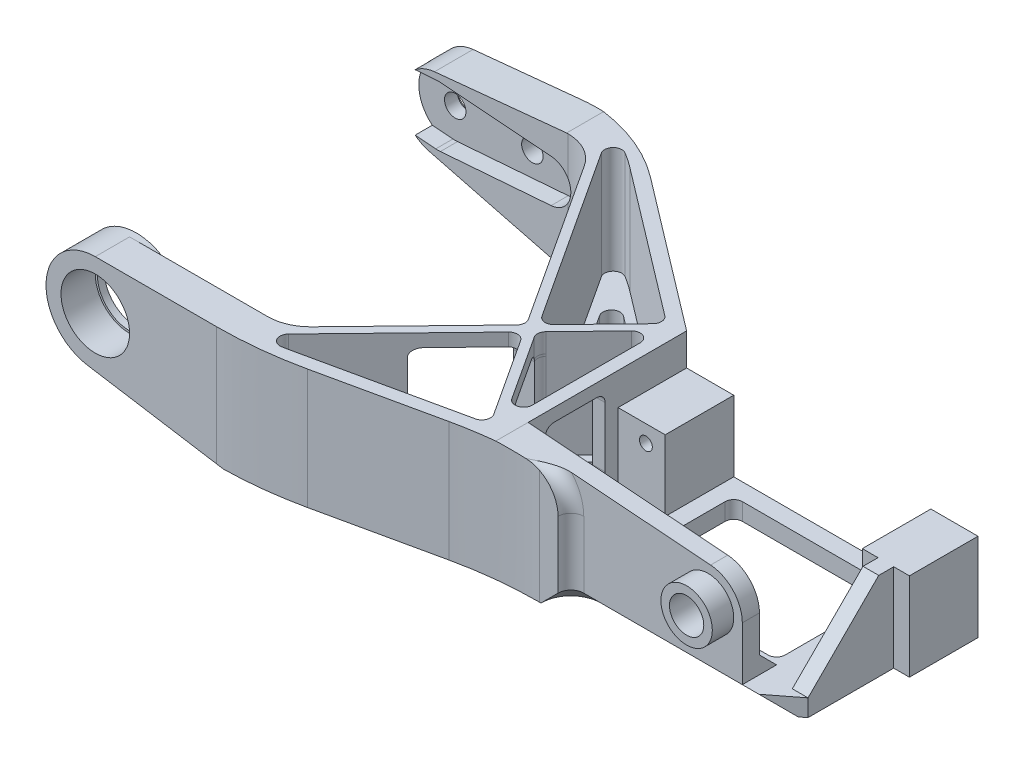
from build123d import *

# Parameters (mm, degrees)
BOSS_EXTRUDE1_DEPTH      = 2
BOSS_EXTRUDE2_DEPTH      = 12
SKETCH3_R                = 2.999999999999994
BOSS_EXTRUDE3_DEPTH      = 1
SKETCH4_R                = 2.0000000000000027
CUT_EXTRUDE1_DEPTH       = 11
SKETCH5_R                = 0.7500000000000021
SKETCH5_R_2              = 0.7500000000000004
CUT_EXTRUDE2_DEPTH       = 11
BOSS_EXTRUDE4_DEPTH      = 14
SKETCH8_R                = 1.2499999999999978
CUT_EXTRUDE3_DEPTH       = 14
SKETCH9_R                = 4.000000000000006
CUT_EXTRUDE4_DEPTH       = 14
CUT_EXTRUDE5_DEPTH       = 14
CUT_EXTRUDE6_DEPTH       = 14
CUT_EXTRUDE7_DEPTH       = 12.5
BOSS_EXTRUDE5_DEPTH      = 12.5
CUT_EXTRUDE8_DEPTH       = 1.5
CUT_EXTRUDE9_REACH       = 65.532
BOSS_EXTRUDE7_START      = 2
BOSS_EXTRUDE7_DEPTH      = 2
FILLET2_R                = 45.00000000000001
FILLET3_R                = 20
BOSS_EXTRUDE6_START      = -1.8333333333333333
BOSS_EXTRUDE6_DEPTH      = 1.8333333333333333
CUT_EXTRUDE10_DEPTH      = 57.152137092011024
SKETCH19_W               = 19.000000000000007
SKETCH19_H               = 14
CUT_EXTRUDE11_DEPTH      = 57.152137092011024
SKETCH20_W               = 6.9999999999999964
SKETCH20_H               = 9.000000000000002
CUT_EXTRUDE12_DEPTH      = 31.666666666666668
FILLET4_R                = 20
CUT_EXTRUDE15_START      = -12
CUT_EXTRUDE15_DEPTH      = 12
FILLET6_R                = 1
BOSS_EXTRUDE8_START      = 0.8
SKETCH22_R               = 5.750000000000003
SKETCH22_R_2             = 3.7499999999999996
BOSS_EXTRUDE8_DEPTH      = 0.8
SKETCH23_W               = 34
SKETCH23_H               = 3.7500000000000018
CUT_EXTRUDE13_DEPTH      = 10.8
CUT_EXTRUDE14_DEPTH      = 10
CUT_EXTRUDE14_DEPTH_BACK = 1.5
SKETCH25_R               = 2.999999999999994
FILLET7_R                = 1.5
CHAMFER1_SIZE            = 2
SKETCH28_R               = 2.5000000000000018
CUT_EXTRUDE16_DEPTH      = 1
CUT_EXTRUDE17_DEPTH      = 20
BOSS_EXTRUDE9_DEPTH      = 12.5
BOSS_EXTRUDE10_DEPTH     = 1.5
FILLET8_R                = 1
FILLET9_R                = 5
FILLET10_R               = 5
CUT_EXTRUDE18_DEPTH      = 20
CUT_EXTRUDE18_DEPTH_BACK = 2
SKETCH32_R               = 2.4999999999999987


# Some blends are built 0.0001 mm under size
with BuildPart() as part:
    # Sketch1 → Boss-Extrude1 (new body)
    with BuildSketch(Plane(origin=(0, 0, 0), x_dir=(1, 0, 0), z_dir=(0, 1, 0))):
        Polygon((0, 0), (2.69e-15, -22), (34, -21.999999999999996), (34, 0), align=None)
    extrude(amount=BOSS_EXTRUDE1_DEPTH)

    # Sketch2 → Boss-Extrude2 (add)
    with BuildSketch(Plane(origin=(0, 2, 0), x_dir=(1, 0, 0), z_dir=(0, 1, 0))):
        Polygon((0, 0), (5.5, 0), (5.500000000000001, -8), (9.8e-16, -8), align=None)
        Polygon((34, 0), (28.500000000000004, -6.7e-16), (28.500000000000004, -8), (34, -8), align=None)
        Polygon((2.69e-15, -22), (34, -22), (34, -18), (0, -18), align=None)
    extrude(amount=BOSS_EXTRUDE2_DEPTH)

    # Sketch3 → Boss-Extrude3 (add)
    with BuildSketch(Plane.XY.offset(22)):
        with Locations(Location((23, 8.25, 0), (0, 0, 180))):
            Circle(SKETCH3_R)
    extrude(amount=BOSS_EXTRUDE3_DEPTH)

    # Sketch4 → Cut-Extrude1 (cut)
    with BuildSketch(Plane.XY.offset(23)):
        with Locations((23.000000000000004, 8.25)):
            Circle(SKETCH4_R)
    extrude(amount=-CUT_EXTRUDE1_DEPTH, mode=Mode.SUBTRACT)

    # Sketch5 → Cut-Extrude2 (cut)
    with BuildSketch(Plane(origin=(0, 0, 0), x_dir=(-1, 0, 0), z_dir=(0, 0, -1))):
        with Locations((-30.750000000000004, 8.25)):
            Circle(SKETCH5_R)
        with Locations((-3.2500000000000027, 8.25)):
            Circle(SKETCH5_R_2)
    extrude(amount=-CUT_EXTRUDE2_DEPTH, mode=Mode.SUBTRACT)

    # Sketch7 → Boss-Extrude4 (add)
    with BuildSketch(Plane.XZ):
        Polygon((-50.49999999999999, 22.999999999999993), (-26.999999999999996, 22.999999999999993), (-26.99999999999999, -15.000000000000007), (-50.49999999999999, -15.000000000000009), (-50.49999999999999, -17.500000000000007), (-22.99999999999999, -17.5), (0, 0), (2.69e-15, 22), (-22.999999999999986, 26.999999999999993), (-50.49999999999999, 26.999999999999993), align=None)
    extrude(amount=-BOSS_EXTRUDE4_DEPTH)

    # Sketch8 → Cut-Extrude3 (cut)
    with BuildSketch(Plane(origin=(4.42e-15, 0, -17.499999999999996), x_dir=(-1, 0, -2.7e-16), z_dir=(2.7e-16, 0, -1))):
        with Locations((41.99999999999999, 8.25)):
            Circle(SKETCH8_R)
        with Locations((32.999999999999986, 8.25)):
            Circle(SKETCH8_R)
    extrude(amount=-CUT_EXTRUDE3_DEPTH, mode=Mode.SUBTRACT)

    # Sketch9 → Cut-Extrude4 (cut)
    with BuildSketch(Plane.XY.offset(26.999999999999993)):
        with Locations((-41.99999999999999, 8.25)):
            Circle(SKETCH9_R)
    extrude(amount=-CUT_EXTRUDE4_DEPTH, mode=Mode.SUBTRACT)

    # Sketch10 → Cut-Extrude5 (cut)
    with BuildSketch(Plane.XY.offset(-15.000000000000005)):
        with BuildLine():
            Line((-27, 14), (-42.41713391946437, 12.479479789907062))
            ThreePointArc((-42.41713391946437, 12.479479789907062), (-46.23746408869767, 8.576187211578807), (-43.059529225196606, 4.134189287521319))
            Line((-43.059529225196606, 4.134189287521319), (-27, 0))
            Line((-27, 0), (-50.49999999999999, 0))
            Line((-50.49999999999999, 0), (-50.49999999999999, 14))
            Line((-50.49999999999999, 14), (-27, 14))
        make_face()
    extrude(amount=-CUT_EXTRUDE5_DEPTH, mode=Mode.SUBTRACT)

    # Sketch11 → Cut-Extrude6 (cut)
    with BuildSketch(Plane(origin=(0, 0, 22.999999999999993), x_dir=(-1, 0, 0), z_dir=(0, 0, -1))):
        with BuildLine():
            Line((26.999999999999996, 0), (42.91778785709473, 2.5737190477065464))
            ThreePointArc((42.91778785709473, 2.5737190477065464), (47.7315406077113, 8.71037187376764), (41.99999999999999, 14.000000000000002))
            Line((41.99999999999999, 14.000000000000002), (53.107989459604404, 14))
            Line((53.107989459604404, 14), (50.75249059667796, -2.6e-16))
            Line((50.75249059667796, -2.6e-16), (26.999999999999996, 0))
        make_face()
    extrude(amount=-CUT_EXTRUDE6_DEPTH, mode=Mode.SUBTRACT)

    # Sketch12 → Cut-Extrude7 (cut)
    with BuildSketch(Plane(origin=(0, 14, 0), x_dir=(1, 0, 0), z_dir=(0, 1, 0))):
        Polygon((-1.4999999999999991, -0.7308367651977024), (-1.4999999999999967, -20.791051874442683), (-23.161161377563868, -25.499999999999993), (-25.499999999999996, -25.499999999999993), (-25.499999999999996, 16), (-23.505474031994225, 16), align=None)
    extrude(amount=-CUT_EXTRUDE7_DEPTH, mode=Mode.SUBTRACT)

    # Sketch13 → Boss-Extrude5 (add)
    with BuildSketch(Plane(origin=(0, 1.5, 0), x_dir=(1, 0, 0), z_dir=(0, 1, 0))):
        Polygon((-24.80378563154179, -25.49999999999999), (-9.397373577762142, -9.599836040721089), (-9.957626569346198, -8.740990337546899), (-25.5, -24.781473027551826), (-25.499999999999996, -25.499999999999993), align=None)
        Polygon((-9.397373577762142, -9.599836040721089), (-8.683812037309256, -8.86340594598965), (-9.24406502889331, -8.004560242815458), (-9.957626569346198, -8.740990337546899), align=None)
        Polygon((-1.4999999999999967, -20.791051874442683), (-1.499999999999997, -19.875906001026767), (-8.683812037309256, -8.863405945989648), (-9.397373577762142, -9.599836040721089), (-2.0228353945063846, -20.90471174281363), align=None)
        Polygon((-9.24406502889331, -8.004560242815458), (-8.683812037309256, -8.863405945989648), (-1.499999999999999, -1.449363737645875), (-1.4999999999999991, -0.7308367651977008), (-1.9008849961326661, -0.426042538899241), align=None)
        Polygon((-9.957626569346198, -8.740990337546899), (-9.24406502889331, -8.00456024281546), (-24.90302057584715, 16.000000000000004), (-25.499999999999996, 16), (-25.499999999999996, 15.084854126584107), align=None)
    extrude(amount=BOSS_EXTRUDE5_DEPTH)

    # Sketch14 → Cut-Extrude8 (cut)
    with BuildSketch(Plane(origin=(0, 1.5, 0), x_dir=(1, 0, 0), z_dir=(0, 1, 0))):
        Polygon((-24.499999999999993, -22.312370614538644), (-24.499999999999993, 11.72160188498378), (-11.231441101383142, -8.618574729104147), align=None)
        Polygon((-3.6531639202682733, -20.23577426615841), (-9.550682126630978, -11.195111838626723), (-22.22194073935927, -24.272464879004225), align=None)
        Polygon((-2.499999999999997, -16.512653759426488), (-2.499999999999997, -3.9184661506589857), (-7.409997505272318, -8.985821554432402), align=None)
        Polygon((-9.090756480024478, -6.409284444909828), (-22.2835643411881, 13.814768821324591), (-3.4035269015017935, -0.539787870567154), align=None)
    extrude(amount=-CUT_EXTRUDE8_DEPTH, mode=Mode.SUBTRACT)

    # Sketch15 → Cut-Extrude9 (cut, up to next)
    with BuildSketch(Plane.XY.offset(22), mode=Mode.PRIVATE) as cut_extrude9_sk1:
        with BuildLine():
            Line((4.5e-16, 14), (23.3015030272886, 12.23862080480656))
            ThreePointArc((23.3015030272886, 12.23862080480656), (25.933088142994887, 10.969741521803641), (26.999999999999996, 8.25))
            Line((26.999999999999996, 8.25), (26.999999999999993, 2))
            Line((26.999999999999993, 2), (34, 2))
            Line((34, 2), (34, 14))
            Line((34, 14), (4.5e-16, 14))
        make_face()
    cut_extrude9_tool1 = extrude(cut_extrude9_sk1.sketch, amount=-CUT_EXTRUDE9_REACH, mode=Mode.PRIVATE) & part.part
    add(cut_extrude9_tool1.solids().sort_by_distance((27.381696, 9.361321, 22))[0], mode=Mode.SUBTRACT)

    # Sketch21 → Boss-Extrude7 (add)
    with BuildSketch(Plane.XY.offset(-15.000000000000005).offset(BOSS_EXTRUDE7_START)):
        with BuildLine():
            ThreePointArc((-26.999999999999943, 6.75000000000008), (-27.796728102183568, 6.0586221822959825), (-28.807692307692307, 5.757407423689289))
            Line((-28.807692307692307, 5.757407423689288), (-41.730769230769226, 4.7603703931649965))
            ThreePointArc((-41.730769230769226, 4.7603703931649965), (-42, 4.75), (-42.26923076923077, 4.760370393164998))
            Line((-42.26923076923077, 4.760370393164998), (-44.672999998769185, 4.945825215491785))
            ThreePointArc((-44.672999998769185, 4.945825215491784), (-43.90987743633794, 4.4533082587379855), (-43.059529225196606, 4.1341892875213215))
            Line((-43.059529225196606, 4.134189287521321), (-27, 0))
            Line((-27, 0), (-27, 6.750000000000096))
        make_face()
        with BuildLine():
            ThreePointArc((-28.807692307692307, 10.742592576310718), (-27.796728102183568, 10.441377817704026), (-26.999999999999943, 9.749999999999927))
            Line((-27, 9.749999999999911), (-27, 13.999999999999995))
            Line((-27, 13.999999999999995), (-42.41713391946437, 12.479479789907062))
            ThreePointArc((-42.41713391946437, 12.47947978990706), (-43.61284817835047, 12.182075883498637), (-44.67299999876919, 11.554174784508215))
            Line((-44.67299999876919, 11.554174784508216), (-42.26923076923077, 11.739629606835004))
            ThreePointArc((-42.26923076923077, 11.739629606835004), (-41.99999999999999, 11.75), (-41.730769230769226, 11.739629606835))
            Line((-41.730769230769226, 11.739629606835), (-28.807692307692307, 10.742592576310717))
        make_face()
    extrude(amount=-BOSS_EXTRUDE7_DEPTH)

    # Fillet2
    fillet2_edges = [part.edges().sort_by_distance(p)[0] for p in [
        (-22.999999999999986, 7, 26.999999999999993),
        (2.69e-15, 7, 22),
    ]]
    fillet(fillet2_edges, radius=FILLET2_R)

    # Fillet3
    fillet3_edges = [part.edges().sort_by_distance(p)[0] for p in [
        (-22.99999999999999, 7, -17.5),
    ]]
    fillet(fillet3_edges, radius=FILLET3_R)

    # Sketch17 → Boss-Extrude6 (add)
    with BuildSketch(Plane(origin=(34, 0, 0), x_dir=(0, 0, -1), z_dir=(1, 0, 0)).offset(BOSS_EXTRUDE6_START)):
        Polygon((-8, 2), (-8.000000000000002, 12.000000000000002), (-18.000000000000004, 2), align=None)
    extrude(amount=-BOSS_EXTRUDE6_DEPTH)

    # Sketch18 → Cut-Extrude10 (cut, through all)
    with BuildSketch(Plane(origin=(0, 2, 0), x_dir=(1, 0, 0), z_dir=(0, 1, 0))):
        Polygon((26.999999999999996, -22), (32.16666666666667, -18.000000000000004), (32.16666666666667, -8), (34, -8), (34, -22), align=None)
    extrude(amount=-CUT_EXTRUDE10_DEPTH, mode=Mode.SUBTRACT)

    # Sketch19 → Cut-Extrude11 (cut, through all)
    with BuildSketch(Plane(origin=(0, 2, 0), x_dir=(1, 0, 0), z_dir=(0, 1, 0))):
        with Locations((17, -9)):
            Rectangle(SKETCH19_W, SKETCH19_H)
    extrude(amount=-CUT_EXTRUDE11_DEPTH, mode=Mode.SUBTRACT)

    # Sketch20 → Cut-Extrude12 (cut)
    with BuildSketch(Plane(origin=(0, 0, 0), x_dir=(-1.2e-16, 0, -1), z_dir=(1, 0, -1.2e-16))):
        with Locations((-12.999999999999998, 8.000000000000002)):
            Rectangle(SKETCH20_W, SKETCH20_H)
    extrude(amount=-CUT_EXTRUDE12_DEPTH, mode=Mode.SUBTRACT)

    # Fillet4
    # the kernel refuses this fillet: 20 mm, written as the material it adds along each edge
    with BuildSketch(Plane(origin=(-23.505474031994225, 14, -16), x_dir=(-1, 0, 4.194e-14), z_dir=(0, -1, 0))) as fillet4_piece_1:
        with BuildLine():
            CenterArc((8.409206628950624, -18.73063327415942), FILLET4_R, 110.52297839821651, 16.722873016890844)
            Line((-3.695520386341062, -2.809716721232338), (-3.9376149266468965, -2.491298390173796))
            Line((-3.9376149266468965, -2.491298390173796), (-0.24209454030583458, 0.3184183310585423))
            Line((-0.24209454030583458, 0.3184183310585423), (-1.678e-14, 0.3999999999999986))
            ThreePointArc((-1.678e-14, 0.3999999999999986), (0.6987732719264567, 0.4000000000000279), (1.257313342150992, 0.37461266548318706))
            Line((1.257313342150992, 0.37461266548318706), (1.3975465438529469, 0))
        make_face()
    extrude(amount=12.5)
    with BuildSketch(Plane(origin=(-23.161161377563868, 14, 25.499999999999993), x_dir=(0.9771763639228016, 0, -0.21242964433104106), z_dir=(0, -1, 0))) as fillet4_piece_2:
        with BuildLine():
            CenterArc((2.1145334406858454, -20.000000000000004), FILLET4_R, 89.99999999999999, 10.718469344394151)
            Line((-1.6051335957935529, -0.34894208604207216), (-1.6795269365231402, 0.0440790722370862))
            ThreePointArc((-1.6795269365231402, 0.0440790722370862), (-0.8875386556291909, 0.21639950254808357), (-0.08497185773241613, 0.39087054556911927))
            Line((-0.08497185773241613, 0.39087054556911927), (-5.8e-16, 0.4000000000000013))
            Line((-5.8e-16, 0.4000000000000013), (2.114533440685851, 0.40000000000000124))
            Line((2.114533440685851, 0.40000000000000124), (2.1145334406858516, -1e-17))
        make_face()
    extrude(amount=12.5)

    # Sketch27 → Cut-Extrude15 (cut)
    with BuildSketch(Plane(origin=(0, 14, 0), x_dir=(1, 0, 0), z_dir=(0, 1, 0)).offset(CUT_EXTRUDE15_START)):
        Polygon((2.2e-15, -18), (26.999999999999996, -18), (26.999999999999996, -18.5), (6e-17, -18.5), align=None)
    extrude(amount=CUT_EXTRUDE15_DEPTH, mode=Mode.SUBTRACT)

    # Fillet6
    # the kernel refuses this fillet: 1 mm, written as the material it adds along each edge
    with BuildSketch(Plane(origin=(26.500000000000004, 2, 2.000000000000001), x_dir=(0, 0, 1), z_dir=(0, -1, 0))) as fillet6_piece_1:
        with BuildLine():
            CenterArc((FILLET6_R, FILLET6_R), FILLET6_R, 180, 90)
            Line((-8.9e-16, FILLET6_R), (0, 0))
            Line((0, 0), (FILLET6_R, 0))
        make_face()
    extrude(amount=2)
    with BuildSketch(Plane(origin=(26.500000000000004, 2, 16), x_dir=(0, 0, -1), z_dir=(0, -1, 0))) as fillet6_piece_2:
        with BuildLine():
            CenterArc((FILLET6_R, -FILLET6_R), FILLET6_R, 90, 89.9999999999998)
            Line((0, -FILLET6_R), (0, 0))
            Line((0, 0), (FILLET6_R, 0))
        make_face()
    extrude(amount=2)
    with BuildSketch(Plane(origin=(7.499999999999998, 2, 16), x_dir=(1, 0, 0), z_dir=(0, -1, 0))) as fillet6_piece_3:
        with BuildLine():
            CenterArc((FILLET6_R, -FILLET6_R), FILLET6_R, 90, 90)
            Line((0, -FILLET6_R), (0, 0))
            Line((0, 0), (FILLET6_R, 0))
        make_face()
    extrude(amount=2)
    with BuildSketch(Plane(origin=(7.499999999999998, 2, 2.000000000000001), x_dir=(0, 0, 1), z_dir=(0, -1, 0))) as fillet6_piece_4:
        with BuildLine():
            CenterArc((FILLET6_R, -FILLET6_R), FILLET6_R, 90, 89.99999999999989)
            Line((0, -FILLET6_R), (0, 0))
            Line((0, 0), (FILLET6_R, 0))
        make_face()
    extrude(amount=2)
    with BuildSketch(Plane(origin=(-25.499999999999996, 12.5, 9.500000000000004), x_dir=(1.2e-16, 0, 1), z_dir=(-1, 0, 1.2e-16))) as fillet6_piece_5:
        with BuildLine():
            CenterArc((FILLET6_R, -FILLET6_R), FILLET6_R, 90, 90)
            Line((0, -FILLET6_R), (0, 0))
            Line((0, 0), (FILLET6_R, 0))
        make_face()
    extrude(amount=1.4999999999999964)
    with BuildSketch(Plane(origin=(1.16e-15, 12.5, 9.5), x_dir=(1.2e-16, 0, 1), z_dir=(-1, 0, 1.2e-16))) as fillet6_piece_6:
        with BuildLine():
            CenterArc((FILLET6_R, -FILLET6_R), FILLET6_R, 90, 90)
            Line((0, -FILLET6_R), (0, 0))
            Line((0, 0), (FILLET6_R, 0))
        make_face()
    extrude(amount=1.4999999999999991)
    with BuildSketch(Plane(origin=(-5.768541026619242, 12.5, 9.5), x_dir=(0, -1, 0), z_dir=(-1, 0, 1.2e-16))) as fillet6_piece_7_section:
        with BuildLine():
            CenterArc((FILLET6_R, FILLET6_R), FILLET6_R, 180, 90)
            Line((0, FILLET6_R), (0, 0))
            Line((0, 0), (FILLET6_R, 0))
        make_face()
    fillet6_piece_7 = extrude(amount=7.424525481742719, mode=Mode.PRIVATE)
    fillet6_piece_7 = split(fillet6_piece_7, bisect_by=Plane(origin=(-8.289063092873498, 12.280120088337053, 9.468540483161206), z_dir=(-0.8375498045171993, 0, 0.5463609841059311)), keep=Keep.TOP, mode=Mode.PRIVATE)
    fillet6_piece_7 = split(fillet6_piece_7, bisect_by=Plane(origin=(-9.124212615356338, 12.280120088337053, 9.317920687920878), z_dir=(0.7181696078856677, 0, 0.6958681012299287)), keep=Keep.TOP, mode=Mode.PRIVATE)
    fillet6_piece_7 = split(fillet6_piece_7, bisect_by=Plane(origin=(-9.126612897390702, 12.280120088337053, 10.01490146726714), z_dir=(0.8375498045172003, 0, -0.5463609841059295)), keep=Keep.TOP, mode=Mode.PRIVATE)
    add(fillet6_piece_7)
    with BuildSketch(Plane(origin=(-5.768541026619242, 12.5, 9.5), x_dir=(0, -1, 0), z_dir=(-1, 0, 1.2e-16))) as fillet6_piece_8_section:
        with BuildLine():
            CenterArc((FILLET6_R, FILLET6_R), FILLET6_R, 180, 90)
            Line((0, FILLET6_R), (0, 0))
            Line((0, 0), (FILLET6_R, 0))
        make_face()
    fillet6_piece_8 = extrude(amount=7.424525481742719, mode=Mode.PRIVATE)
    fillet6_piece_8 = split(fillet6_piece_8, bisect_by=Plane(origin=(-9.348823528983395, 12.081147055371739, 9.549730037251988), z_dir=(-0.7181696078856677, 0, -0.6958681012299287)), keep=Keep.TOP, mode=Mode.PRIVATE)
    fillet6_piece_8 = split(fillet6_piece_8, bisect_by=Plane(origin=(-9.431936596322846, 12.081147055371739, 9.546852298687588), z_dir=(0.8375498045172003, 0, -0.5463609841059295)), keep=Keep.TOP, mode=Mode.PRIVATE)
    add(fillet6_piece_8)
    with BuildSketch(Plane(origin=(-5.768541026619242, 12.5, 9.5), x_dir=(0, -1, 0), z_dir=(-1, 0, 1.2e-16))) as fillet6_piece_9_section:
        with BuildLine():
            CenterArc((FILLET6_R, FILLET6_R), FILLET6_R, 180, 90)
            Line((0, FILLET6_R), (0, 0))
            Line((0, 0), (FILLET6_R, 0))
        make_face()
    fillet6_piece_9 = extrude(amount=7.424525481742719, mode=Mode.PRIVATE)
    fillet6_piece_9 = split(fillet6_piece_9, bisect_by=Plane(origin=(-10.589985785451336, 12.279164616943406, 9.393615697827723), z_dir=(0.718169607885668, 0, 0.6958681012299285)), keep=Keep.TOP, mode=Mode.PRIVATE)
    fillet6_piece_9 = split(fillet6_piece_9, bisect_by=Plane(origin=(-9.871816177565668, 12.279164616943406, 10.08948379905765), z_dir=(-0.7181696078856677, 0, -0.6958681012299287)), keep=Keep.TOP, mode=Mode.PRIVATE)
    fillet6_piece_9 = split(fillet6_piece_9, bisect_by=Plane(origin=(-9.58828248654587, 12.279164616943406, 9.307180225456289), z_dir=(-0.8375498045172003, 0, 0.5463609841059295)), keep=Keep.TOP, mode=Mode.PRIVATE)
    add(fillet6_piece_9)
    with BuildSketch(Plane(origin=(-25.499999999999996, 3.5, 9.500000000000004), x_dir=(1.2e-16, 0, 1), z_dir=(-1, 0, 1.2e-16))) as fillet6_piece_10:
        with BuildLine():
            CenterArc((FILLET6_R, FILLET6_R), FILLET6_R, 180, 90)
            Line((0, FILLET6_R), (0, 0))
            Line((0, 0), (FILLET6_R, 0))
        make_face()
    extrude(amount=1.4999999999999964)
    with BuildSketch(Plane(origin=(1.16e-15, 3.5, 9.5), x_dir=(0, 1, 0), z_dir=(-1, 0, 1.2e-16))) as fillet6_piece_11:
        with BuildLine():
            CenterArc((FILLET6_R, -FILLET6_R), FILLET6_R, 90, 90)
            Line((0, -FILLET6_R), (0, 0))
            Line((0, 0), (FILLET6_R, 0))
        make_face()
    extrude(amount=1.4999999999999991)
    with BuildSketch(Plane(origin=(-5.768541026619242, 3.5, 9.5), x_dir=(1.2e-16, 0, 1), z_dir=(-1, 0, 1.2e-16))) as fillet6_piece_12_section:
        with BuildLine():
            CenterArc((FILLET6_R, FILLET6_R), FILLET6_R, 180, 90)
            Line((0, FILLET6_R), (0, 0))
            Line((0, 0), (FILLET6_R, 0))
        make_face()
    fillet6_piece_12 = extrude(amount=7.424525481742719, mode=Mode.PRIVATE)
    fillet6_piece_12 = split(fillet6_piece_12, bisect_by=Plane(origin=(-8.289063095435276, 3.7198799163040013, 9.468540479234102), z_dir=(-0.8375498045171993, 0, 0.5463609841059311)), keep=Keep.TOP, mode=Mode.PRIVATE)
    fillet6_piece_12 = split(fillet6_piece_12, bisect_by=Plane(origin=(-9.12661289995248, 3.7198799163040013, 10.014901463340035), z_dir=(0.8375498045172003, 0, -0.5463609841059295)), keep=Keep.TOP, mode=Mode.PRIVATE)
    fillet6_piece_12 = split(fillet6_piece_12, bisect_by=Plane(origin=(-9.124212625300894, 3.7198799163040013, 9.317920698184142), z_dir=(0.7181696078856677, 0, 0.6958681012299287)), keep=Keep.TOP, mode=Mode.PRIVATE)
    add(fillet6_piece_12)
    with BuildSketch(Plane(origin=(-5.768541026619242, 3.5, 9.5), x_dir=(1.2e-16, 0, 1), z_dir=(-1, 0, 1.2e-16))) as fillet6_piece_13_section:
        with BuildLine():
            CenterArc((FILLET6_R, FILLET6_R), FILLET6_R, 180, 90)
            Line((0, FILLET6_R), (0, 0))
            Line((0, 0), (FILLET6_R, 0))
        make_face()
    fillet6_piece_13 = extrude(amount=7.424525481742719, mode=Mode.PRIVATE)
    fillet6_piece_13 = split(fillet6_piece_13, bisect_by=Plane(origin=(-9.431936595773676, 3.9188529618602486, 9.546852299529442), z_dir=(0.8375498045172003, 0, -0.5463609841059295)), keep=Keep.TOP, mode=Mode.PRIVATE)
    fillet6_piece_13 = split(fillet6_piece_13, bisect_by=Plane(origin=(-9.348823530131575, 3.9188529618602486, 9.549730038436966), z_dir=(-0.7181696078856677, 0, -0.6958681012299287)), keep=Keep.TOP, mode=Mode.PRIVATE)
    add(fillet6_piece_13)
    with BuildSketch(Plane(origin=(-5.768541026619242, 3.5, 9.5), x_dir=(1.2e-16, 0, 1), z_dir=(-1, 0, 1.2e-16))) as fillet6_piece_14_section:
        with BuildLine():
            CenterArc((FILLET6_R, FILLET6_R), FILLET6_R, 180, 90)
            Line((0, FILLET6_R), (0, 0))
            Line((0, 0), (FILLET6_R, 0))
        make_face()
    fillet6_piece_14 = extrude(amount=7.424525481742719, mode=Mode.PRIVATE)
    fillet6_piece_14 = split(fillet6_piece_14, bisect_by=Plane(origin=(-9.588282479940304, 3.720835386992669, 9.30718023558236), z_dir=(-0.8375498045172003, 0, 0.5463609841059295)), keep=Keep.TOP, mode=Mode.PRIVATE)
    fillet6_piece_14 = split(fillet6_piece_14, bisect_by=Plane(origin=(-9.871816171823465, 3.720835386992669, 10.089483793131418), z_dir=(-0.7181696078856677, 0, -0.6958681012299287)), keep=Keep.TOP, mode=Mode.PRIVATE)
    fillet6_piece_14 = split(fillet6_piece_14, bisect_by=Plane(origin=(-10.589985779709133, 3.720835386992669, 9.393615691901491), z_dir=(0.718169607885668, 0, 0.6958681012299285)), keep=Keep.TOP, mode=Mode.PRIVATE)
    add(fillet6_piece_14)
    with BuildSketch(Plane(origin=(-25.499999999999996, 3.5, 16.5), x_dir=(-1.2e-16, 0, -1), z_dir=(-1, 0, 1.2e-16))) as fillet6_piece_15:
        with BuildLine():
            CenterArc((FILLET6_R, -FILLET6_R), FILLET6_R, 90, 90)
            Line((0, -FILLET6_R), (0, 0))
            Line((0, 0), (FILLET6_R, 0))
        make_face()
    extrude(amount=1.5)
    with BuildSketch(Plane(origin=(2.02e-15, 3.5, 16.499999999999996), x_dir=(0, 1, 0), z_dir=(-1, 0, 1.2e-16))) as fillet6_piece_16:
        with BuildLine():
            CenterArc((FILLET6_R, FILLET6_R), FILLET6_R, 180, 90)
            Line((0, FILLET6_R), (0, 0))
            Line((0, 0), (FILLET6_R, 0))
        make_face()
    extrude(amount=1.4999999999999991)
    with BuildSketch(Plane(origin=(2.02e-15, 3.5, 16.499999999999996), x_dir=(0, 1, 0), z_dir=(-1, 0, 1.2e-16))) as fillet6_piece_17_section:
        with BuildLine():
            CenterArc((FILLET6_R, FILLET6_R), FILLET6_R, 180, 90)
            Line((0, FILLET6_R), (0, 0))
            Line((0, 0), (FILLET6_R, 0))
        make_face()
    fillet6_piece_17 = extrude(amount=3.9999999999999996, mode=Mode.PRIVATE)
    fillet6_piece_17 = split(fillet6_piece_17, bisect_by=Plane(origin=(-3.800749570568012, 3.811595178675906, 16.348947800990498), z_dir=(-0.8375498045171993, 0, 0.5463609841059311)), keep=Keep.TOP, mode=Mode.PRIVATE)
    add(fillet6_piece_17)
    with BuildSketch(Plane(origin=(-13.583264960237655, 3.5, 16.499999999999993), x_dir=(-1.2e-16, 0, -1), z_dir=(-1, 0, 1.2e-16))) as fillet6_piece_18_section:
        with BuildLine():
            CenterArc((FILLET6_R, -FILLET6_R), FILLET6_R, 90, 90)
            Line((0, -FILLET6_R), (0, 0))
            Line((0, 0), (FILLET6_R, 0))
        make_face()
    fillet6_piece_18 = extrude(amount=6.392428736916413, mode=Mode.PRIVATE)
    fillet6_piece_18 = split(fillet6_piece_18, bisect_by=Plane(origin=(-16.201029716852666, 3.72639511426682, 16.621538936662667), z_dir=(-0.7181696078856677, 0, -0.6958681012299287)), keep=Keep.TOP, mode=Mode.PRIVATE)
    fillet6_piece_18 = split(fillet6_piece_18, bisect_by=Plane(origin=(-16.919199324738337, 3.72639511426682, 15.925670835432744), z_dir=(0.718169607885668, 0, 0.6958681012299285)), keep=Keep.TOP, mode=Mode.PRIVATE)
    add(fillet6_piece_18)
    with BuildSketch(Plane(origin=(-1.2022133072233292, 3.5, 16.499999999999996), x_dir=(-1.2e-16, 0, -1), z_dir=(-1, 0, 1.2e-16))) as fillet6_piece_19_section:
        with BuildLine():
            CenterArc((FILLET6_R, -FILLET6_R), FILLET6_R, 90, 90)
            Line((0, -FILLET6_R), (0, 0))
            Line((0, 0), (FILLET6_R, 0))
        make_face()
    fillet6_piece_19 = extrude(amount=6.193958848305697, mode=Mode.PRIVATE)
    fillet6_piece_19 = split(fillet6_piece_19, bisect_by=Plane(origin=(-1.4999999999999971, 3.7263951142668255, 16.273604885733167), z_dir=(1, 0, -1.2e-16)), keep=Keep.TOP, mode=Mode.PRIVATE)
    add(fillet6_piece_19)
    with BuildSketch(Plane(origin=(-1.2022133072233292, 3.5, 16.499999999999996), x_dir=(-1.2e-16, 0, -1), z_dir=(-1, 0, 1.2e-16))) as fillet6_piece_20_section:
        with BuildLine():
            CenterArc((FILLET6_R, -FILLET6_R), FILLET6_R, 90, 90)
            Line((0, -FILLET6_R), (0, 0))
            Line((0, 0), (FILLET6_R, 0))
        make_face()
    fillet6_piece_20 = extrude(amount=6.193958848305697, mode=Mode.PRIVATE)
    fillet6_piece_20 = split(fillet6_piece_20, bisect_by=Plane(origin=(-4.028102726964268, 3.7263951142668117, 16.000424393874127), z_dir=(-0.8375498045171993, 0, 0.5463609841059311)), keep=Keep.TOP, mode=Mode.PRIVATE)
    fillet6_piece_20 = split(fillet6_piece_20, bisect_by=Plane(origin=(-4.865652531481484, 3.7263951142668117, 16.54678537798007), z_dir=(0.8375498045172003, 0, -0.5463609841059295)), keep=Keep.TOP, mode=Mode.PRIVATE)
    add(fillet6_piece_20)
    with BuildSketch(Plane(origin=(-25.499999999999996, 12.5, 16.5), x_dir=(0, -1, 0), z_dir=(-1, 0, 1.2e-16))) as fillet6_piece_21:
        with BuildLine():
            CenterArc((FILLET6_R, -FILLET6_R), FILLET6_R, 90, 90)
            Line((0, -FILLET6_R), (0, 0))
            Line((0, 0), (FILLET6_R, 0))
        make_face()
    extrude(amount=1.5)
    with BuildSketch(Plane(origin=(2.02e-15, 12.5, 16.499999999999996), x_dir=(0, -1, 0), z_dir=(-1, 0, 1.2e-16))) as fillet6_piece_22:
        with BuildLine():
            CenterArc((FILLET6_R, -FILLET6_R), FILLET6_R, 90, 90)
            Line((0, -FILLET6_R), (0, 0))
            Line((0, 0), (FILLET6_R, 0))
        make_face()
    extrude(amount=1.4999999999999991)
    with BuildSketch(Plane(origin=(2.02e-15, 12.5, 16.499999999999996), x_dir=(0, -1, 0), z_dir=(-1, 0, 1.2e-16))) as fillet6_piece_23_section:
        with BuildLine():
            CenterArc((FILLET6_R, -FILLET6_R), FILLET6_R, 90, 90)
            Line((0, -FILLET6_R), (0, 0))
            Line((0, 0), (FILLET6_R, 0))
        make_face()
    fillet6_piece_23 = extrude(amount=3.9999999999999996, mode=Mode.PRIVATE)
    fillet6_piece_23 = split(fillet6_piece_23, bisect_by=Plane(origin=(-3.800749570568012, 12.188404821324095, 16.348947800990498), z_dir=(-0.8375498045171993, 0, 0.5463609841059311)), keep=Keep.TOP, mode=Mode.PRIVATE)
    add(fillet6_piece_23)
    with BuildSketch(Plane(origin=(-1.2022133072233292, 12.5, 16.499999999999996), x_dir=(-1.2e-16, 0, -1), z_dir=(-1, 0, 1.2e-16))) as fillet6_piece_24_section:
        with BuildLine():
            CenterArc((FILLET6_R, FILLET6_R), FILLET6_R, 180, 90)
            Line((0, FILLET6_R), (0, 0))
            Line((0, 0), (FILLET6_R, 0))
        make_face()
    fillet6_piece_24 = extrude(amount=6.193958848305697, mode=Mode.PRIVATE)
    fillet6_piece_24 = split(fillet6_piece_24, bisect_by=Plane(origin=(-1.4999999999999971, 12.273604885733175, 16.27360488573317), z_dir=(1, 0, -1.2e-16)), keep=Keep.TOP, mode=Mode.PRIVATE)
    add(fillet6_piece_24)
    with BuildSketch(Plane(origin=(-1.2022133072233292, 12.5, 16.499999999999996), x_dir=(-1.2e-16, 0, -1), z_dir=(-1, 0, 1.2e-16))) as fillet6_piece_25_section:
        with BuildLine():
            CenterArc((FILLET6_R, FILLET6_R), FILLET6_R, 180, 90)
            Line((0, FILLET6_R), (0, 0))
            Line((0, 0), (FILLET6_R, 0))
        make_face()
    fillet6_piece_25 = extrude(amount=6.193958848305697, mode=Mode.PRIVATE)
    fillet6_piece_25 = split(fillet6_piece_25, bisect_by=Plane(origin=(-4.028102726964276, 12.273604885733182, 16.000424393874113), z_dir=(-0.8375498045171993, 0, 0.5463609841059311)), keep=Keep.TOP, mode=Mode.PRIVATE)
    fillet6_piece_25 = split(fillet6_piece_25, bisect_by=Plane(origin=(-4.865652531481492, 12.273604885733182, 16.546785377980058), z_dir=(0.8375498045172003, 0, -0.5463609841059295)), keep=Keep.TOP, mode=Mode.PRIVATE)
    add(fillet6_piece_25)
    with BuildSketch(Plane(origin=(-13.583264960237655, 12.5, 16.499999999999996), x_dir=(0, -1, 0), z_dir=(-1, 0, 1.2e-16))) as fillet6_piece_26_section:
        with BuildLine():
            CenterArc((FILLET6_R, -FILLET6_R), FILLET6_R, 90, 90)
            Line((0, -FILLET6_R), (0, 0))
            Line((0, 0), (FILLET6_R, 0))
        make_face()
    fillet6_piece_26 = extrude(amount=6.392428736916413, mode=Mode.PRIVATE)
    fillet6_piece_26 = split(fillet6_piece_26, bisect_by=Plane(origin=(-16.919199324738337, 12.273604885733175, 15.925670835432744), z_dir=(0.718169607885668, 0, 0.6958681012299285)), keep=Keep.TOP, mode=Mode.PRIVATE)
    fillet6_piece_26 = split(fillet6_piece_26, bisect_by=Plane(origin=(-16.201029716852666, 12.273604885733175, 16.621538936662667), z_dir=(-0.7181696078856677, 0, -0.6958681012299287)), keep=Keep.TOP, mode=Mode.PRIVATE)
    add(fillet6_piece_26)

    # Sketch22 → Boss-Extrude8 (add)
    with BuildSketch(Plane(origin=(0, 0, 22.999999999999993), x_dir=(-1, 0, 0), z_dir=(0, 0, -1)).offset(BOSS_EXTRUDE8_START)):
        with Locations((41.99999999999999, 8.25)):
            Circle(SKETCH22_R)
        with Locations((41.99999999999999, 8.25)):
            Circle(SKETCH22_R_2, mode=Mode.SUBTRACT)
    extrude(amount=-BOSS_EXTRUDE8_DEPTH)

    # Sketch23 → Cut-Extrude13 (cut)
    with BuildSketch(Plane(origin=(0, 0, 0), x_dir=(-1, 0, 0), z_dir=(0, 0, -1))):
        with Locations((-17, 12.125)):
            Rectangle(SKETCH23_W, SKETCH23_H)
    extrude(amount=-CUT_EXTRUDE13_DEPTH, mode=Mode.SUBTRACT)

    # Sketch25 → Cut-Extrude14 (cut, two sides: drawn at the far end of the back side and taken through both)
    # profile 1 of 3: a face of its own
    with BuildSketch(Plane.XY.offset(22).offset(-CUT_EXTRUDE14_DEPTH_BACK)):
        with BuildLine():
            ThreePointArc((26.999999999999993, 8.25), (25.933088142994883, 10.969741521803638), (23.3015030272886, 12.238620804806562))
            Line((23.3015030272886, 12.23862080480656), (4.83484132691677, 13.63453048864189))
            Line((4.834841326916764, 13.634530488641893), (4.834841326916764, 13.316159390826787))
            ThreePointArc((4.834841326916902, 13.316159390826833), (6.416091722104923, 11.842757405325827), (6.999999999999993, 9.761815948637008))
            Line((6.999999999999994, 9.761815948637008), (6.999999999999996, -2.45e-15))
            Line((6.9999999999999964, -2.45e-15), (26.999999999999993, -1.73e-15))
            Line((26.999999999999993, 0), (26.999999999999993, 2))
            Line((26.999999999999993, 2), (26.999999999999993, 8.25))
        make_face()
        with Locations((23, 8.25)):
            Circle(SKETCH25_R, mode=Mode.SUBTRACT)
    # profile 2 of 3: a face of its own
    with BuildSketch(Plane.XY.offset(22).offset(-CUT_EXTRUDE14_DEPTH_BACK)):
        with BuildLine():
            Line((4.834841326916764, 13.316159390826787), (4.834841326916764, 13.634530488641893))
            Line((4.83484132691677, 13.63453048864189), (3.3015030272885895, 13.750436753443582))
            ThreePointArc((3.301503027288589, 13.75043675344358), (4.090018810322446, 13.610433751581756), (4.834841326916902, 13.316159390826833))
        make_face()
    # profile 3 of 3: a face of its own
    with BuildSketch(Plane.XY.offset(22).offset(-CUT_EXTRUDE14_DEPTH_BACK)):
        Polygon((30.35912699943746, 2), (26.999999999999993, 2), (26.999999999999993, 0), (30.35912699943746, -3.6e-16), align=None)
    extrude(amount=CUT_EXTRUDE14_DEPTH + CUT_EXTRUDE14_DEPTH_BACK, mode=Mode.SUBTRACT)

    # Fillet7
    fillet7_edges = [part.edges().sort_by_distance(p)[0] for p in [
        (5.933088142994883, 12.481557470440654, 20.5),
        (6.999999999999997, 4.880907974318503, 20.5),
    ]]
    fillet(fillet7_edges, radius=FILLET7_R - 0.0001)  # a hair under: the kernel refuses the full size

    # Chamfer1
    chamfer1_edges = [part.edges().sort_by_distance(p)[0] for p in [
        (7.439310538898296, -1.9e-16, 20.939310538898297),
        (18.7187, -1.42e-15, 20.5),
        (13.499999999999998, 2, 18.5),
    ]]
    chamfer(chamfer1_edges, length=CHAMFER1_SIZE)

    # Sketch28 → Cut-Extrude16 (cut)
    with BuildSketch(Plane(origin=(4.42e-15, 0, -17.499999999999996), x_dir=(-1, 0, -2.5e-16), z_dir=(2.5e-16, 0, -1))):
        with Locations((41.99999999999999, 8.25)):
            Circle(SKETCH28_R)
    extrude(amount=-CUT_EXTRUDE16_DEPTH, mode=Mode.SUBTRACT)

    # Sketch29 → Cut-Extrude17 (cut)
    with BuildSketch(Plane(origin=(0, 14, 0), x_dir=(1, 0, 0), z_dir=(0, 1, 0))):
        Polygon((-26.999999999999996, -22.999999999999993), (-23.77384751531817, -23), (-24.13998183012604, 13.000000000000005), (-26.99999999999999, 13.000000000000005), align=None)
    extrude(amount=-CUT_EXTRUDE17_DEPTH, mode=Mode.SUBTRACT)

    # Sketch30 → Boss-Extrude9 (add)
    with BuildSketch(Plane(origin=(0, 14, 0), x_dir=(1, 0, 0), z_dir=(0, 1, 0))):
        Polygon((-25.499999999999996, -22.999999999999996), (-23.77384751531817, -23), (-25.499999999999996, -24.78147302755182), align=None)
        Polygon((-25.499999999999996, 15.08485412658406), (-25.499999999999996, 13.000000000000005), (-24.13998183012604, 13.000000000000005), align=None)
    extrude(amount=-BOSS_EXTRUDE9_DEPTH)

    # Sketch31 → Boss-Extrude10 (add)
    with BuildSketch(Plane(origin=(0, 1.5, 0), x_dir=(1, 0, 0), z_dir=(0, 1, 0))):
        Polygon((-24.121072218973424, 11.140720566299777), (-25.33394067843172, 13.000000000000007), (-24.13998183012603, 13.000000000000007), align=None)
        Polygon((-23.7883111104983, -21.5778731863527), (-25.16627625223465, -22.999999999999993), (-23.773847515318167, -22.999999999999996), align=None)
    extrude(amount=-BOSS_EXTRUDE10_DEPTH)

    # Fillet8
    fillet8_edges = [part.edges().sort_by_distance(p)[0] for p in [
        (-22.22194073935927, 0.75, 24.272464879004225),
        (-24.803785631541793, 7.75, 25.499999999999993),
        (-7.409997505272318, 0.75, 8.985821554432402),
        (-8.683812037309256, 7.75, 8.863405945989648),
        (-1.4999999999999964, 7.75, 19.875906001026767),
        (-2.499999999999997, 0.75, 16.512653759426488),
        (-1.4999999999999991, 7.75, 1.449363737645875),
        (-2.499999999999997, 0.75, 3.9184661506589857),
        (-9.550682126630978, 0.75, 11.195111838626723),
        (-9.397373577762123, 2.782224400807401, 9.59983604072094),
        (-2.022835394506384, 7.75, 20.90471174281363),
        (-3.6531639202682733, 0.75, 20.23577426615841),
        (-9.957626569346198, 7.75, 8.740990337546899),
        (-11.231441101383142, 0.75, 8.618574729104147),
        (-1.9008849961326661, 7.75, 0.42604253889924093),
        (-3.4035269015017935, 0.75, 0.539787870567154),
        (-9.090756480024478, 0.75, 6.409284444909828),
        (-9.24406502889331, 7.75, 8.004560242815458),
        (-22.2835643411881, 0.75, -13.814768821324591),
        (-24.90302057584715, 7.75, -16),
        (-9.39737357776215, 12.967775599193109, 9.599836040721186),
    ]]
    fillet(fillet8_edges, radius=FILLET8_R)

    # Fillet9
    fillet9_edges = [part.edges().sort_by_distance(p)[0] for p in [
        (-25.16627625223465, 0.75, 22.999999999999993),
        (-25.33394067843172, 0.75, -13.000000000000007),
    ]]
    fillet(fillet9_edges, radius=FILLET9_R)

    # Fillet10
    fillet10_edges = [part.edges().sort_by_distance(p)[0] for p in [
        (-23.77384751531817, 7.75, 23),
        (-24.13998183012604, 7.75, -13.000000000000005),
    ]]
    fillet(fillet10_edges, radius=FILLET10_R)

    # Sketch32 → Cut-Extrude18 (cut, two sides: drawn at the far end of the back side and taken through both)
    with BuildSketch(Plane.XY.offset(-13.000000000000005).offset(-CUT_EXTRUDE18_DEPTH_BACK)):
        with Locations((-28.999999999999996, 8.250000000000002)):
            Circle(SKETCH32_R)
    extrude(amount=CUT_EXTRUDE18_DEPTH + CUT_EXTRUDE18_DEPTH_BACK, mode=Mode.SUBTRACT)


solid = part.part
